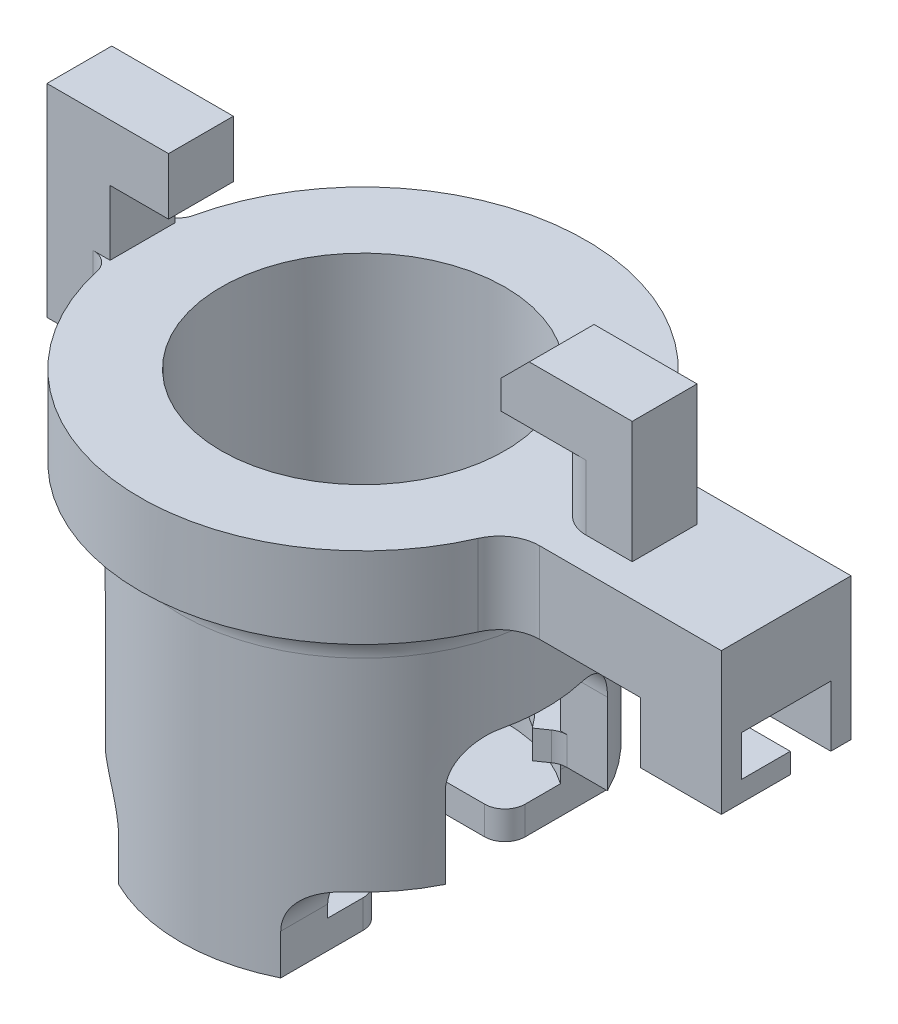
from build123d import *

# Parameters (mm, degrees)
SKETCH_1_R                       = 4.5
SKETCH_1_R_2                     = 3.5
EXTRUDE_1_DEPTH                  = 8
EXTRUDE_START                    = 2
SKETCH_2_R                       = 5.5
SKETCH_2_R_2                     = 3.5
EXTRUDE_2_DEPTH                  = 2
SKETCH_3_W                       = 3
SKETCH_3_H                       = 1.6
EXTRUDE_3_DEPTH                  = 3
EXTRUDE_4_REACH                  = 13.969
SKETCH_4_W                       = 1.441507144
SKETCH_4_H                       = 1.6
CUT_EXTRUDE_3_DEPTH              = 13.356779516
CUT_EXTRUDE_5_DEPTH              = 10
CUT_EXTRUDE_5_DEPTH_BACK         = 10
SKETCH_7_W                       = 4
SKETCH_7_H                       = 5
FILLET_1_R                       = 1
CUT_EXTRUDE_7_DEPTH              = 10
CUT_EXTRUDE_7_DEPTH_BACK         = 10
SKETCH_8_W                       = 2.031128874
SKETCH_8_H                       = 2
FILLET_2_R                       = 1
EXTRUDE_5_REACH                  = 13.969
EXTRUDE_5_END_RADIUS             = 3.5
SKETCH_10_W                      = 4
SKETCH_10_H                      = 0.7
EXTRUDE_5_DIRECTION_2_REACH      = 13.969
EXTRUDE_5_DIRECTION_2_END_RADIUS = 3.5
CUT_EXTRUDE_8_DEPTH              = 16.755951257
CUT_EXTRUDE_8_DEPTH_BACK         = 16.755951257
SKETCH_11_W                      = 4
SKETCH_11_H                      = 3
FILLET_3_R                       = 0.5
EXTRUDE_START_2                  = -0.7
EXTRUDE_6_DEPTH                  = 0.7
FILLET_4_R                       = 0.5
SKETCH_14_W                      = 6
SKETCH_14_H                      = 1.6
EXTRUDE_7_DEPTH                  = 3
EXTRUDE_8_DEPTH                  = 2
SKETCH_16_W                      = 1.7
SKETCH_16_H                      = 1.6
CUT_EXTRUDE_9_DEPTH              = 3
SKETCH_17_W                      = 1.241507144
SKETCH_17_H                      = 1.6
CUT_EXTRUDE_10_DEPTH             = 14.264237694
CUT_EXTRUDE_11_DEPTH             = 14.264237694
FILLET_5_R                       = 0.5
SKETCH_19_W                      = 1.058492856
SKETCH_19_H                      = 5
CUT_EXTRUDE_12_DEPTH             = 14.264237694
FILLET_6_R                       = 1
CUT_EXTRUDE_15_DEPTH             = 1.6
EXTRUDE_START_3                  = -2
EXTRUDE_13_DEPTH                 = 2
EXTRUDE_14_DEPTH                 = 3
SKETCH_27_W                      = 0.5
SKETCH_27_H                      = 1.5
EXTRUDE_15_DEPTH                 = 2
FILLET_7_R                       = 1


# Some blends are built 0.0001 mm under size
with BuildPart() as part:
    # 草图1 → 凸台-拉伸1 (new body)
    with BuildSketch(Plane(origin=(0, 0, 0), x_dir=(1, 0, 0), z_dir=(0, 1, 0))):
        with Locations(Location((0, 0, 0), (0, 0, 270))):
            Circle(SKETCH_1_R)
        with Locations(Location((0, 0, 0), (0, 0, 270))):
            Circle(SKETCH_1_R_2, mode=Mode.SUBTRACT)
    extrude(amount=-EXTRUDE_1_DEPTH)

    # 草图2 → 凸台-拉伸2 (add)
    with BuildSketch(Plane(origin=(0, 0, 0), x_dir=(1, 0, 0), z_dir=(0, 1, 0)).offset(EXTRUDE_START)):
        with Locations(Location((0, 0, 0), (0, 0, 270))):
            Circle(SKETCH_2_R)
        with Locations(Location((0, 0, 0), (0, 0, 270))):
            Circle(SKETCH_2_R_2, mode=Mode.SUBTRACT)
    extrude(amount=-EXTRUDE_2_DEPTH)

    # 草图3 → 凸台-拉伸3 (add)
    with BuildSketch(Plane(origin=(0, 2, 0), x_dir=(1, 0, 0), z_dir=(0, 1, 0))):
        with Locations((-5.5, 0)):
            Rectangle(SKETCH_3_W, SKETCH_3_H)
    extrude(amount=EXTRUDE_3_DEPTH)

    # 草图5 → 凸台-拉伸4 (add, up to next)
    with BuildSketch(Plane.XZ, mode=Mode.PRIVATE) as extrude_4_sk1:
        with BuildLine():
            Line((-5.441507144, -0.8), (-7, -0.8))
            Line((-7, -0.8), (-7, 0.8))
            Line((-7, 0.8), (-5.441507144, 0.8))
            ThreePointArc((-5.441507144, 0.8), (-5.5, 0), (-5.441507144, -0.8))
        make_face()
    extrude_4_tool1 = extrude(extrude_4_sk1.sketch, amount=-EXTRUDE_4_REACH, mode=Mode.PRIVATE) - part.part
    add(extrude_4_tool1.solids().sort_by_distance((-6.240172, 0, 0))[0])

    # 草图4 → 切除-拉伸3 (cut, through all)
    with BuildSketch(Plane.XY.offset(0.8)):
        with Locations((-4.720753572, 2.8)):
            Rectangle(SKETCH_4_W, SKETCH_4_H)
    extrude(amount=-CUT_EXTRUDE_3_DEPTH, mode=Mode.SUBTRACT)

    # 草图7 → 切除-拉伸5 (cut, two sides: drawn at the far end of the back side and taken through both)
    with BuildSketch(Plane(origin=(0, 0, 0), x_dir=(0, 0, -1), z_dir=(1, 0, 0)).offset(-CUT_EXTRUDE_5_DEPTH_BACK)):
        with Locations((0, -5.5)):
            Rectangle(SKETCH_7_W, SKETCH_7_H)
    extrude(amount=CUT_EXTRUDE_5_DEPTH + CUT_EXTRUDE_5_DEPTH_BACK, mode=Mode.SUBTRACT)

    # 圆角1
    fillet_1_edges = [part.edges().sort_by_distance(p)[0] for p in [
        (-3.451705099, -3, 2),
        (3.451705099, -3, 2),
        (-3.451705099, -3, -2),
        (3.451705099, -3, -2),
    ]]
    fillet(fillet_1_edges, radius=FILLET_1_R)

    # 草图8 → 切除-拉伸7 (cut, two sides: drawn at the far end of the back side and taken through both)
    with BuildSketch(Plane.XY.offset(-CUT_EXTRUDE_7_DEPTH_BACK)):
        with Locations((-3.015564437, -7)):
            Rectangle(SKETCH_8_W, SKETCH_8_H)
        with Locations((3.015564437, -7)):
            Rectangle(SKETCH_8_W, SKETCH_8_H)
    extrude(amount=CUT_EXTRUDE_7_DEPTH + CUT_EXTRUDE_7_DEPTH_BACK, mode=Mode.SUBTRACT)

    # 圆角2
    fillet_2_edges = [part.edges().sort_by_distance(p)[0] for p in [
        (2, -6, -3.451705099),
        (2, -6, 3.451705099),
        (-2, -6, 3.451705099),
        (-2, -6, -3.451705099),
    ]]
    fillet(fillet_2_edges, radius=FILLET_2_R)

    # 凸台-拉伸5: up to this cylinder (the profile starts inside it)
    extrude_5_end = Plane(origin=(0, -7.65, 0), z_dir=(0, 1, 0)) * Cylinder(EXTRUDE_5_END_RADIUS, 35.938, mode=Mode.PRIVATE)
    # 草图10 → 凸台-拉伸5 (add, up to the surface)
    with BuildSketch(Plane.XY, mode=Mode.PRIVATE) as extrude_5_sk1:
        with Locations((0, -7.65)):
            Rectangle(SKETCH_10_W, SKETCH_10_H)
    extrude_5_tool1 = extrude(extrude_5_sk1.sketch, amount=EXTRUDE_5_REACH, mode=Mode.PRIVATE) & extrude_5_end
    add(extrude_5_tool1.solids().sort_by_distance((0, -7.65, 0))[0])

    # 凸台-拉伸5 direction 2: up to this cylinder (the profile starts inside it)
    extrude_5_direction_2_end = Plane(origin=(0, -7.65, 0), z_dir=(0, 1, 0)) * Cylinder(EXTRUDE_5_DIRECTION_2_END_RADIUS, 35.938, mode=Mode.PRIVATE)
    # 草图10 → 凸台-拉伸5 direction 2 (add, up to the surface)
    with BuildSketch(Plane.XY, mode=Mode.PRIVATE) as extrude_5_direction_2_sk1:
        with Locations((0, -7.65)):
            Rectangle(SKETCH_10_W, SKETCH_10_H)
    extrude_5_direction_2_tool1 = extrude(extrude_5_direction_2_sk1.sketch, amount=-EXTRUDE_5_DIRECTION_2_REACH, mode=Mode.PRIVATE) & extrude_5_direction_2_end
    add(extrude_5_direction_2_tool1.solids().sort_by_distance((0, -7.65, 0))[0])

    # 草图11 → 切除-拉伸8 (cut, two sides: drawn at the far end of the back side and taken through both)
    with BuildSketch(Plane.XZ.offset(8).offset(-CUT_EXTRUDE_8_DEPTH_BACK)):
        Rectangle(SKETCH_11_W, SKETCH_11_H)
    extrude(amount=CUT_EXTRUDE_8_DEPTH + CUT_EXTRUDE_8_DEPTH_BACK, mode=Mode.SUBTRACT)

    # 圆角3
    fillet_3_edges = [part.edges().sort_by_distance(p)[0] for p in [
        (-2, -7.65, -1.5),
        (-2, -7.65, 1.5),
        (2, -7.65, 1.5),
        (2, -7.65, -1.5),
    ]]
    fillet(fillet_3_edges, radius=FILLET_3_R)

    # 草图12 → 凸台-拉伸6 (add)
    with BuildSketch(Plane(origin=(0, -6, 0), x_dir=(-1, 0, 0), z_dir=(0, -1, 0)).offset(EXTRUDE_START_2)):
        with BuildLine():
            Line((-2.46195542, 1.714285714), (-2.872281323, 2))
            ThreePointArc((-2.872281323, 2), (-1.838197137, 2.978427653), (-0.5, 3.464101615))
            Line((-0.5, 3.464101615), (-0.5, 2.958039892))
            ThreePointArc((-0.5, 2.958039892), (-1.606245962, 2.533766743), (-2.46195542, 1.714285714))
        make_face()
        with BuildLine():
            Line((2.46195542, 1.714285714), (2.872281323, 2))
            ThreePointArc((2.872281323, 2), (1.838197137, 2.978427653), (0.5, 3.464101615))
            Line((0.5, 3.464101615), (0.5, 2.958039892))
            ThreePointArc((0.5, 2.958039892), (1.606245962, 2.533766743), (2.46195542, 1.714285714))
        make_face()
        with BuildLine():
            Line((2.46195542, -1.714285714), (2.872281323, -2))
            ThreePointArc((2.872281323, -2), (1.838197137, -2.978427653), (0.5, -3.464101615))
            Line((0.5, -3.464101615), (0.5, -2.958039892))
            ThreePointArc((0.5, -2.958039892), (1.606245962, -2.533766743), (2.46195542, -1.714285714))
        make_face()
        with BuildLine():
            Line((-2.46195542, -1.714285714), (-2.872281323, -2))
            ThreePointArc((-2.872281323, -2), (-1.838197137, -2.978427653), (-0.5, -3.464101615))
            Line((-0.5, -3.464101615), (-0.5, -2.958039892))
            ThreePointArc((-0.5, -2.958039892), (-1.606245962, -2.533766743), (-2.46195542, -1.714285714))
        make_face()
    extrude(amount=EXTRUDE_6_DEPTH)

    # 圆角4
    # the kernel refuses this fillet: 0.5 mm, written as the material it adds along each edge
    with BuildSketch(Plane(origin=(2.872281323, -5.3, -2), x_dir=(1, 0, 0), z_dir=(0, -1, 0)), Plane(origin=(-2.872281323, -5.3, 2), x_dir=(-1, 0, 0), z_dir=(0, -1, 0))) as fillet_4_piece_1:
        with BuildLine():
            CenterArc((FILLET_4_R * 0.313859338365, FILLET_4_R), FILLET_4_R, 235.150095421, 34.849904579)
            Line((-FILLET_4_R * 0.257569233063, FILLET_4_R * 0.179348193352), (0, 0))
            Line((0, 0), (FILLET_4_R * 0.313859338365, 0))
        make_face()
    extrude(amount=0.7)
    with BuildSketch(Plane(origin=(-2.872281323, -5.3, -2), x_dir=(-1, 0, 0), z_dir=(0, -1, 0)), Plane(origin=(2.872281323, -5.3, 2), x_dir=(1, 0, 0), z_dir=(0, -1, 0))) as fillet_4_piece_2:
        with BuildLine():
            CenterArc((FILLET_4_R * 0.313859338365, -FILLET_4_R), FILLET_4_R, 90, 34.849904579)
            Line((-FILLET_4_R * 0.257569233063, -FILLET_4_R * 0.179348193352), (0, 0))
            Line((0, 0), (FILLET_4_R * 0.313859338365, 0))
        make_face()
    extrude(amount=0.7)

    # 草图14 → 凸台-拉伸7 (add)
    with BuildSketch(Plane(origin=(0, 2, 0), x_dir=(1, 0, 0), z_dir=(0, 1, 0))):
        with Locations((5.5, 0)):
            Rectangle(SKETCH_14_W, SKETCH_14_H)
    extrude(amount=EXTRUDE_7_DEPTH)

    # 草图15 → 凸台-拉伸8 (add)
    with BuildSketch(Plane.XZ.offset(-2)):
        with BuildLine():
            Line((8.5, 0.8), (5.441507144, 0.8))
            ThreePointArc((5.441507144, 0.8), (5.5, 0), (5.441507144, -0.8))
            Line((5.441507144, -0.8), (8.5, -0.8))
            Line((8.5, -0.8), (8.5, 0.8))
        make_face()
    extrude(amount=EXTRUDE_8_DEPTH)

    # 草图16 → 切除-拉伸9 (cut)
    with BuildSketch(Plane(origin=(0, 5, 0), x_dir=(1, 0, 0), z_dir=(0, 1, 0))):
        with Locations((3.35, 0)):
            Rectangle(SKETCH_16_W, SKETCH_16_H)
    extrude(amount=-CUT_EXTRUDE_9_DEPTH, mode=Mode.SUBTRACT)

    # 草图17 → 切除-拉伸10 (cut, through all)
    with BuildSketch(Plane.XY.offset(0.8)):
        with Locations((4.820753572, 2.8)):
            Rectangle(SKETCH_17_W, SKETCH_17_H)
    extrude(amount=-CUT_EXTRUDE_10_DEPTH, mode=Mode.SUBTRACT)

    # 草图18 → 切除-拉伸11 (cut, through all)
    with BuildSketch(Plane.XY.offset(0.8)):
        Polygon((4.2, 4.3), (4.9, 5), (4.2, 5), align=None)
    extrude(amount=-CUT_EXTRUDE_11_DEPTH, mode=Mode.SUBTRACT)

    # 圆角5
    fillet_5_edges = [part.edges().sort_by_distance(p)[0] for p in [
        (-5.441507144, 1, 0.8),
        (-5.441507144, 1, -0.8),
        (5.441507144, 1, -0.8),
        (5.441507144, 1, 0.8),
    ]]
    fillet(fillet_5_edges, radius=FILLET_5_R)

    # 草图19 → 切除-拉伸12 (cut, through all)
    with BuildSketch(Plane(origin=(0, 0, -0.8), x_dir=(-1, 0, 0), z_dir=(0, 0, -1))):
        with Locations((-7.970753572, 2.5)):
            Rectangle(SKETCH_19_W, SKETCH_19_H)
    extrude(amount=-CUT_EXTRUDE_12_DEPTH, mode=Mode.SUBTRACT)

    # 圆角6
    fillet_6_edges = [part.edges().sort_by_distance(p)[0] for p in [
        (0, 0, -4.5),
    ]]
    fillet(fillet_6_edges, radius=FILLET_6_R - 0.0001)  # a hair under: the kernel refuses the full size

    # 草图21 → 切除-拉伸15 (cut)
    with BuildSketch(Plane(origin=(0, 3.6, 0), x_dir=(1, 0, 0), z_dir=(0, 1, 0))):
        with BuildLine():
            Line((4.9, 0.8), (4.9, -0.8))
            Line((4.9, -0.8), (6.3, -0.8))
            ThreePointArc((6.3, -0.8), (5.5, 0), (6.3, 0.8))
            Line((6.3, 0.8), (4.9, 0.8))
        make_face()
    extrude(amount=-CUT_EXTRUDE_15_DEPTH, mode=Mode.SUBTRACT)

    # 草图24 → 凸台-拉伸13 (add)
    with BuildSketch(Plane.XZ.offset(EXTRUDE_START_3)):
        with BuildLine():
            Line((7.441507144, 1.6), (5.262128847, 1.6))
            ThreePointArc((5.262128847, 1.6), (5.319659308, 1.3968625), (5.369351037, 1.191666667))
            ThreePointArc((5.369351037, 1.191666667), (5.5, 0), (5.369351037, -1.191666667))
            ThreePointArc((5.369351037, -1.191666667), (5.319659308, -1.3968625), (5.262128847, -1.6))
            Line((5.262128847, -1.6), (7.441507144, -1.6))
            Line((7.441507144, -1.6), (7.441507144, 1.6))
        make_face()
    extrude(amount=EXTRUDE_13_DEPTH)

    # 草图25 → 凸台-拉伸14 (add)
    with BuildSketch(Plane(origin=(7.441507144, 0, 0), x_dir=(0, 0, -1), z_dir=(1, 0, 0))):
        Polygon((-0.8, 2), (0.8, 2), (1.6, 2), (1.6, 0), (-1.6, 0), (-1.6, 2), align=None)
    extrude(amount=EXTRUDE_14_DEPTH)

    # 草图27 → 凸台-拉伸15 (add)
    with BuildSketch(Plane(origin=(10.441507144, 0, 0), x_dir=(0, 0, -1), z_dir=(1, 0, 0))):
        Polygon((-1.6, 0), (-1.6, -1.5), (0.1, -1.5), (0.1, -1), (-1.1, -1), (-1.1, 0), align=None)
        with Locations((1.35, -0.75)):
            Rectangle(SKETCH_27_W, SKETCH_27_H)
    extrude(amount=-EXTRUDE_15_DEPTH)

    # 圆角7
    fillet_7_edges = [part.edges().sort_by_distance(p)[0] for p in [
        (5.262128847, 1, 1.6),
        (5.262128847, 1, -1.6),
    ]]
    fillet(fillet_7_edges, radius=FILLET_7_R)


solid = part.part
